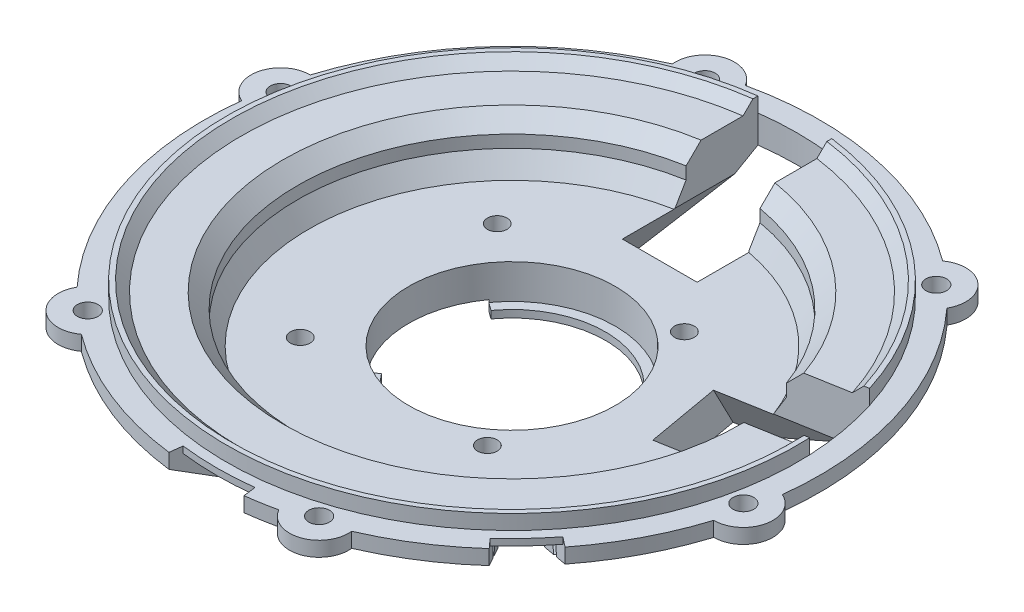
from build123d import *

# Parameters (mm, degrees)
SKETCH5_R           = 1.449999999
SKETCH5_R_2         = 1.450000001
CUT_EXTRUDE2_DEPTH  = 91.622844802
CUT_REVOLVE1_ANGLE  = 14
CUT_REVOLVE2_ANGLE  = 10
CUT_EXTRUDE5_DEPTH  = 16.5
SKETCH11_R          = 2.1
CUT_EXTRUDE3_DEPTH  = 91.008332948
CUT_EXTRUDE4_START  = -3
SKETCH12_R          = 6.5
CUT_EXTRUDE4_DEPTH  = 88.008333105
BOSS_EXTRUDE1_DEPTH = 3
CHAMFER1_SIZE       = 4
CHAMFER1_SIZE2      = 2.309401077
SKETCH18_R          = 2
CUT_EXTRUDE6_DEPTH  = 6.5
CUT_EXTRUDE7_DEPTH  = 2
CUT_EXTRUDE9_START  = 1
SKETCH21_W          = 15
SKETCH21_H          = 33
CUT_EXTRUDE9_DEPTH  = 92.554064501
SKETCH22_R          = 2
CUT_EXTRUDE10_DEPTH = 6
CUT_EXTRUDE11_DEPTH = 94.861626108
CHAMFER2_SIZE       = 8.660254038
CHAMFER2_SIZE_2     = 5
CHAMFER3_SIZE       = 3
CUT_EXTRUDE12_START = 17
CUT_EXTRUDE12_DEPTH = 4
CUT_EXTRUDE13_START = 17
CUT_EXTRUDE13_DEPTH = 4


with BuildPart() as part:
    # Sketch3 → Revolve1 (revolve)
    with BuildSketch(Plane.XY, mode=Mode.PRIVATE) as revolve1_sk:
        Polygon((38.251288694, 0), (62.5, 14), (62.5, 17), (57.925, 17), (57.925, 20), (56.925, 20), (54.925, 18), (43.5, 18), (43.5, 8.5), (20.975, 8.5), (20.975, 1.5), (18.975, 1.5), (18.975, 0), align=None)
    revolve(revolve1_sk.sketch.rotate(Axis((0, 0, 0), (0, 1, 0)), 90), axis=Axis((0, 0, 0), (0, 1, 0)))

    # Sketch5 → Cut-Extrude2 (cut, through all)
    with BuildSketch(Plane.XZ):
        with Locations(Location((15, 20, 0), (0, 0, 270))):
            Circle(SKETCH5_R)
        with Locations(Location((15, -20, 0), (0, 0, 270))):
            Circle(SKETCH5_R_2)
        with Locations(Location((-23, 20, 0), (0, 0, 270))):
            Circle(SKETCH5_R)
        with Locations(Location((-23, -20, 0), (0, 0, 270))):
            Circle(SKETCH5_R_2)
    extrude(amount=-CUT_EXTRUDE2_DEPTH, mode=Mode.SUBTRACT)

    # Sketch6 → Cut-Revolve1 (revolve, symmetric, cut)
    with BuildSketch(Plane(origin=(0, 0, 0), x_dir=(0, 0, -1), z_dir=(1, 0, 0))) as cut_revolve1_sk:
        Polygon((-62.5, 14), (-62.5, 17), (-59.925, 17), (-59.925, 15.673577095), (-32.777568136, 0), (-38.251288694, 0), align=None)
    revolve(axis=Axis((0, 0, 0), (0, 1, 0)), revolution_arc=CUT_REVOLVE1_ANGLE / 2, mode=Mode.SUBTRACT)
    revolve(cut_revolve1_sk.sketch, axis=Axis((0, 0, 0), (0, -1, 0)), revolution_arc=CUT_REVOLVE1_ANGLE / 2, mode=Mode.SUBTRACT)

    # Sketch13 → Cut-Revolve2 (revolve, symmetric, cut)
    with BuildSketch(Plane(origin=(0, 0, 0), x_dir=(-0.731353701619167, 0, -0.6819983600625024), z_dir=(0.6819983600625024, 0, -0.731353701619167))) as cut_revolve2_sk:
        Polygon((-62.5, 14), (-62.5, 17), (-59.925, 17), (-59.925, 15.673577095), (-32.777568136, 0), (-38.251288694, 0), align=None)
    revolve(axis=Axis((0, 0, 0), (0, 1, 0)), revolution_arc=CUT_REVOLVE2_ANGLE / 2, mode=Mode.SUBTRACT)
    revolve(cut_revolve2_sk.sketch, axis=Axis((0, 0, 0), (0, -1, 0)), revolution_arc=CUT_REVOLVE2_ANGLE / 2, mode=Mode.SUBTRACT)

    # Sketch15 → Cut-Extrude5 (cut, symmetric)
    with BuildSketch(Plane(origin=(0, 0, 0), x_dir=(-1, 0, 0), z_dir=(0, 0, -1))):
        Polygon((25, 0), (25, 7.5), (40, 7.5), (44.11473671, 3.38526329), (38.251288694, 0), align=None)
    extrude(amount=CUT_EXTRUDE5_DEPTH, both=True, mode=Mode.SUBTRACT)

    # Sketch11 → Cut-Extrude3 (cut, through all)
    with BuildSketch(Plane(origin=(0, 17, 0), x_dir=(1, 0, 0), z_dir=(0, 1, 0))):
        with Locations((-59.667003645, 12.68261314)):
            Circle(SKETCH11_R)
        with Locations((-18.850036657, 58.014447494)):
            Circle(SKETCH11_R)
        with Locations((40.816966988, 45.331834354)):
            Circle(SKETCH11_R)
        with Locations((59.667003645, -12.68261314)):
            Circle(SKETCH11_R)
        with Locations((18.850036657, -58.014447494)):
            Circle(SKETCH11_R)
        with Locations((-40.816966988, -45.331834354)):
            Circle(SKETCH11_R)
    extrude(amount=-CUT_EXTRUDE3_DEPTH, mode=Mode.SUBTRACT)

    # Sketch12 → Cut-Extrude4 (cut, through all)
    with BuildSketch(Plane(origin=(0, 17, 0), x_dir=(1, 0, 0), z_dir=(0, 1, 0)).offset(CUT_EXTRUDE4_START)):
        with Locations((-40.816966988, -45.331834354)):
            Circle(SKETCH12_R)
        with Locations((18.850036657, -58.014447494)):
            Circle(SKETCH12_R)
        with Locations((59.667003645, -12.68261314)):
            Circle(SKETCH12_R)
        with Locations((40.816966988, 45.331834354)):
            Circle(SKETCH12_R)
        with Locations((-18.850036657, 58.014447494)):
            Circle(SKETCH12_R)
        with Locations((-59.667003645, 12.68261314)):
            Circle(SKETCH12_R)
    extrude(amount=-CUT_EXTRUDE4_DEPTH, mode=Mode.SUBTRACT)

    # Sketch17 → Boss-Extrude1 (add)
    with BuildSketch(Plane(origin=(0, 17, 0), x_dir=(1, 0, 0), z_dir=(0, 1, 0))):
        with BuildLine():
            ThreePointArc((-59.642366287, 18.682562556), (-65.535889249, 13.930083285), (-62.084895583, 7.191365688))
            ThreePointArc((-62.084895583, 7.191365688), (-61.793731404, 9.369352122), (-61.426185799, 11.535757374))
            ThreePointArc((-61.426185799, 11.535757374), (-61.721113606, 13.119227691), (-60.807628247, 14.44584186))
            ThreePointArc((-60.807628247, 14.44584186), (-60.262241465, 16.574445802), (-59.642366287, 18.682562556))
        make_face()
        with BuildLine():
            ThreePointArc((-17.893348094, 59.883871735), (-19.498972345, 60.011666178), (-20.722833962, 58.964516046))
            ThreePointArc((-20.722833962, 58.964516046), (-22.782768747, 58.199617251), (-24.814542418, 57.36277961))
            ThreePointArc((-24.814542418, 57.36277961), (-20.704138623, 63.720786592), (-13.641609362, 60.993085625))
            ThreePointArc((-13.641609362, 60.993085625), (-15.777229614, 60.475854898), (-17.893348094, 59.883871735))
        make_face()
        with BuildLine():
            ThreePointArc((42.914280153, 45.438029876), (42.222141261, 46.892438488), (40.703351837, 47.428758673))
            ThreePointArc((40.703351837, 47.428758673), (39.010962657, 48.830265129), (37.270353165, 50.171413922))
            ThreePointArc((37.270353165, 50.171413922), (44.831750626, 49.790703307), (46.000756925, 42.310523068))
            ThreePointArc((46.000756925, 42.310523068), (44.485011851, 43.901409096), (42.914280153, 45.438029876))
        make_face()
        with BuildLine():
            ThreePointArc((60.807628247, -14.44584186), (61.721113606, -13.119227691), (61.426185799, -11.535757374))
            ThreePointArc((61.426185799, -11.535757374), (61.793731404, -9.369352122), (62.084895583, -7.191365688))
            ThreePointArc((62.084895583, -7.191365688), (65.535889249, -13.930083285), (59.642366287, -18.682562556))
            ThreePointArc((59.642366287, -18.682562556), (60.262241465, -16.574445802), (60.807628247, -14.44584186))
        make_face()
        with BuildLine():
            ThreePointArc((17.893348094, -59.883871735), (19.498972345, -60.011666178), (20.722833962, -58.964516046))
            ThreePointArc((20.722833962, -58.964516046), (22.782768747, -58.199617251), (24.814542418, -57.36277961))
            ThreePointArc((24.814542418, -57.36277961), (20.704138623, -63.720786592), (13.641609362, -60.993085625))
            ThreePointArc((13.641609362, -60.993085625), (15.777229614, -60.475854898), (17.893348094, -59.883871735))
        make_face()
        with BuildLine():
            ThreePointArc((-42.914280153, -45.438029876), (-42.222141261, -46.892438488), (-40.703351837, -47.428758673))
            ThreePointArc((-40.703351837, -47.428758673), (-39.010962657, -48.830265129), (-37.270353165, -50.171413922))
            ThreePointArc((-37.270353165, -50.171413922), (-44.831750626, -49.790703307), (-46.000756925, -42.310523068))
            ThreePointArc((-46.000756925, -42.310523068), (-44.485011851, -43.901409096), (-42.914280153, -45.438029876))
        make_face()
    extrude(amount=-BOSS_EXTRUDE1_DEPTH)

    # Chamfer1
    chamfer1_edges = [part.edges().sort_by_distance(p)[0] for p in [
        (0, 8.5, 43.5),
    ]]
    chamfer1_side = [part.faces().sort_by_distance(p)[0] for p in [
        (0, 13.25, 43.5),
    ]]
    chamfer(chamfer1_edges, length=CHAMFER1_SIZE, length2=CHAMFER1_SIZE2, reference=chamfer1_side[0])

    # Sketch18 → Cut-Extrude6 (cut)
    with BuildSketch(Plane(origin=(0, 8.5, 0), x_dir=(1, 0, 0), z_dir=(0, 1, 0))):
        with Locations(Location((-23, -20, 0), (0, 0, 270))):
            Circle(SKETCH18_R)
        with Locations(Location((-23, 20, 0), (0, 0, 270))):
            Circle(SKETCH18_R)
        with Locations(Location((15, 20, 0), (0, 0, 270))):
            Circle(SKETCH18_R)
        with Locations(Location((15, -20, 0), (0, 0, 270))):
            Circle(SKETCH18_R)
    extrude(amount=-CUT_EXTRUDE6_DEPTH, mode=Mode.SUBTRACT)

    # Sketch19 → Cut-Extrude7 (cut)
    with BuildSketch(Plane.XZ):
        with BuildLine():
            Line((-17, 17.5), (-17, 12.286196523))
            Line((-17, 12.286196523), (-15.379022646, 11.114687915))
            ThreePointArc((-15.379022646, 11.114687915), (-18.975, 0), (-15.379022646, -11.114687915))
            Line((-15.379022646, -11.114687915), (-17, -12.286196523))
            Line((-17, -12.286196523), (-17, -17.5))
            Line((-17, -17.5), (-25, -17.5))
            Line((-25, -17.5), (-25, 17.5))
            Line((-25, 17.5), (-17, 17.5))
        make_face()
    extrude(amount=-CUT_EXTRUDE7_DEPTH, mode=Mode.SUBTRACT)

    # Sketch21 → Cut-Extrude9 (cut, through all)
    with BuildSketch(Plane.XZ.offset(-7.5).offset(CUT_EXTRUDE9_START)):
        with Locations((-47.5, 0)):
            Rectangle(SKETCH21_W, SKETCH21_H)
    extrude(amount=CUT_EXTRUDE9_DEPTH, mode=Mode.SUBTRACT)

    # Sketch22 → Cut-Extrude10 (cut)
    with BuildSketch(Plane.XZ.offset(-6.5)):
        with Locations(Location((-45, 13.5, 0), (0, 0, 270))):
            Circle(SKETCH22_R)
        with Locations(Location((-45, -13.5, 0), (0, 0, 270))):
            Circle(SKETCH22_R)
    extrude(amount=-CUT_EXTRUDE10_DEPTH, mode=Mode.SUBTRACT)

    # Sketch23 → Cut-Extrude11 (cut, through all)
    with BuildSketch(Plane.XZ):
        with BuildLine():
            Line((-7.5, -30), (-7.5, -57.437406148))
            ThreePointArc((-7.5, -57.437406148), (0, -57.925), (7.5, -57.437406148))
            Line((7.5, -57.437406148), (7.5, -30))
            Line((7.5, -30), (-7.5, -30))
        make_face()
        with BuildLine():
            Line((30.846593923, 2.176612818), (57.86716422, -2.58784276))
            ThreePointArc((57.86716422, -2.58784276), (57.044989093, -10.058570691), (55.262441555, -17.359959055))
            Line((55.262441555, -17.359959055), (28.241871258, -12.595503478))
            Line((28.241871258, -12.595503478), (30.846593923, 2.176612818))
        make_face()
    extrude(amount=-CUT_EXTRUDE11_DEPTH, mode=Mode.SUBTRACT)

    # Chamfer2
    # the kernel refuses this chamfer: 8.660254038, 5 mm, written as the material it takes off along each edge
    with BuildSketch(Plane(origin=(7.5, 0, -59.913633307), x_dir=(-0.019326765612700594, 0.999813220622208, 0), z_dir=(0, 0, 1)), Plane(origin=(-7.5, 0, -30), x_dir=(0.019326765612700594, 0.999813220622208, 0), z_dir=(0, 0, -1))) as chamfer2_piece_1:
        Polygon((CHAMFER2_SIZE * 0.999813220604, -CHAMFER2_SIZE * 0.0193267656124), (-CHAMFER2_SIZE_2 * 0.0193267656127, -CHAMFER2_SIZE_2 * 0.999813220622), (0, 0), align=None)
    extrude(amount=29.913633307, mode=Mode.SUBTRACT)
    with BuildSketch(Plane(origin=(30.846593923, 0, 2.176612818), x_dir=(0.17335692517629364, -0.05789386240267139, 0.9831559780571553), z_dir=(0.9848077530122085, 0, -0.17364817766692803))) as chamfer2_piece_2:
        Polygon((CHAMFER2_SIZE_2 * 0.998322743754, -CHAMFER2_SIZE_2 * 0.0578938624027), (-CHAMFER2_SIZE * 0.0578938624016, -CHAMFER2_SIZE * 0.998322743736), (0, 0), align=None)
    extrude(amount=29.913633307, mode=Mode.SUBTRACT)
    with BuildSketch(Plane(origin=(57.70104926, 0, -17.789951389), x_dir=(0.003356057628841287, 0.999813220622208, 0.01903314861603721), z_dir=(-0.9848077530122086, 0, 0.1736481776669277))) as chamfer2_piece_3:
        Polygon((CHAMFER2_SIZE * 0.999813220604, CHAMFER2_SIZE * 0.0193267656124), (-CHAMFER2_SIZE_2 * 0.0193267656127, CHAMFER2_SIZE_2 * 0.999813220622), (0, 0), align=None)
    extrude(amount=29.913633307, mode=Mode.SUBTRACT)

    # Chamfer3
    chamfer3_edges = [part.edges().sort_by_distance(p)[0] for p in [
        (27.961261021, 18, -33.322933276),
        (-27.961261021, 18, 33.322933276),
    ]]
    chamfer(chamfer3_edges, length=CHAMFER3_SIZE)

    # Sketch24 → Cut-Extrude12 (cut)
    with BuildSketch(Plane(origin=(0, 0, 32.777568136), x_dir=(1, 0, 0), z_dir=(0, 0.49999999999999994, 0.8660254037844387)).offset(CUT_EXTRUDE12_START)):
        with BuildLine():
            Line((-0.000938226, 1.8), (1.280841417, 1.8))
            ThreePointArc((1.280841417, 1.8), (3.530598051, 0.981155551), (4.727668553, -1.092231378))
            Line((4.727668553, -1.092231378), (5, -2.636699765))
            add(Edge.make_bspline(
                [(5, -2.636699765), (6.008428215, -2.596232935), (7.013708715, -2.539468423)],
                knots=[1.650881907, 1.650881907, 1.650881907, 1.683252544, 1.683252544, 1.683252544], degree=2, weights=[1, 0.999869021, 1]))
            Line((7.013708715, -2.539468423), (6.697284059, -0.744935023))
            ThreePointArc((6.697284059, -0.744935023), (4.81617327, 2.513244437), (1.280841417, 3.8))
            Line((1.280841417, 3.8), (-0.000938226, 3.8))
            Line((-0.000938226, 3.8), (-1.280841417, 3.8))
            ThreePointArc((-1.280841417, 3.8), (-4.81617327, 2.513244437), (-6.697284059, -0.744935023))
            Line((-6.697284059, -0.744935023), (-7.013708715, -2.539468423))
            add(Edge.make_bspline(
                [(-7.013708715, -2.539468423), (-6.008428215, -2.596232935), (-5, -2.636699765)],
                knots=[1.458340109, 1.458340109, 1.458340109, 1.490710747, 1.490710747, 1.490710747], degree=2, weights=[1, 0.999869021, 1]))
            Line((-5, -2.636699765), (-4.727668553, -1.092231378))
            ThreePointArc((-4.727668553, -1.092231378), (-3.530598051, 0.981155551), (-1.280841417, 1.8))
            Line((-1.280841417, 1.8), (-0.000938226, 1.8))
        make_face()
    extrude(amount=CUT_EXTRUDE12_DEPTH, mode=Mode.SUBTRACT)

    # Sketch26 → Cut-Extrude13 (cut)
    with BuildSketch(Plane(origin=(23.971995786, 0, 22.354247715), x_dir=(0.4635842165482516, 0.3659658406372113, -0.8069440362590475), z_dir=(0.6333708847539831, 0.49999999999999967, 0.5906279051534536)).offset(CUT_EXTRUDE13_START)):
        with BuildLine():
            Line((0.760645716, 1.63138533), (0.859101161, 1.585479736))
            ThreePointArc((0.859101161, 1.585479736), (2.068374751, 0.376305702), (2.217489977, -1.327281429))
            Line((2.217489977, -1.327281429), (1.577652212, -3.715581732))
            add(Edge.make_bspline(
                [(1.577652212, -3.715581732), (2.503986982, -4.120696082), (3.435324753, -4.510105632)],
                knots=[1.618814778, 1.618814778, 1.618814778, 1.651193406, 1.651193406, 1.651193406], degree=2, weights=[1, 0.999868956, 1]))
            Line((3.435324753, -4.510105632), (4.149362937, -1.844839994))
            ThreePointArc((4.149362937, -1.844839994), (3.880955529, 1.221616841), (1.704263067, 3.398130103))
            Line((1.704263067, 3.398130103), (1.605807622, 3.444035697))
            Line((1.605807622, 3.444035697), (1.507352177, 3.489941291))
            ThreePointArc((1.507352177, 3.489941291), (-1.559126745, 3.758096236), (-4.080552559, 1.992420185))
            Line((-4.080552559, 1.992420185), (-5.663103507, -0.267894826))
            add(Edge.make_bspline(
                [(-5.663103507, -0.267894826), (-4.766107979, -0.730959468), (-3.860298889, -1.180096013)],
                knots=[1.490399247, 1.490399247, 1.490399247, 1.522777876, 1.522777876, 1.522777876], degree=2, weights=[1, 0.999868956, 1]))
            Line((-3.860298889, -1.180096013), (-2.44220125, 0.845334754))
            ThreePointArc((-2.44220125, 0.845334754), (-1.04140913, 1.826265894), (0.662190271, 1.677290924))
            Line((0.662190271, 1.677290924), (0.760645716, 1.63138533))
        make_face()
    extrude(amount=CUT_EXTRUDE13_DEPTH, mode=Mode.SUBTRACT)


solid = part.part
